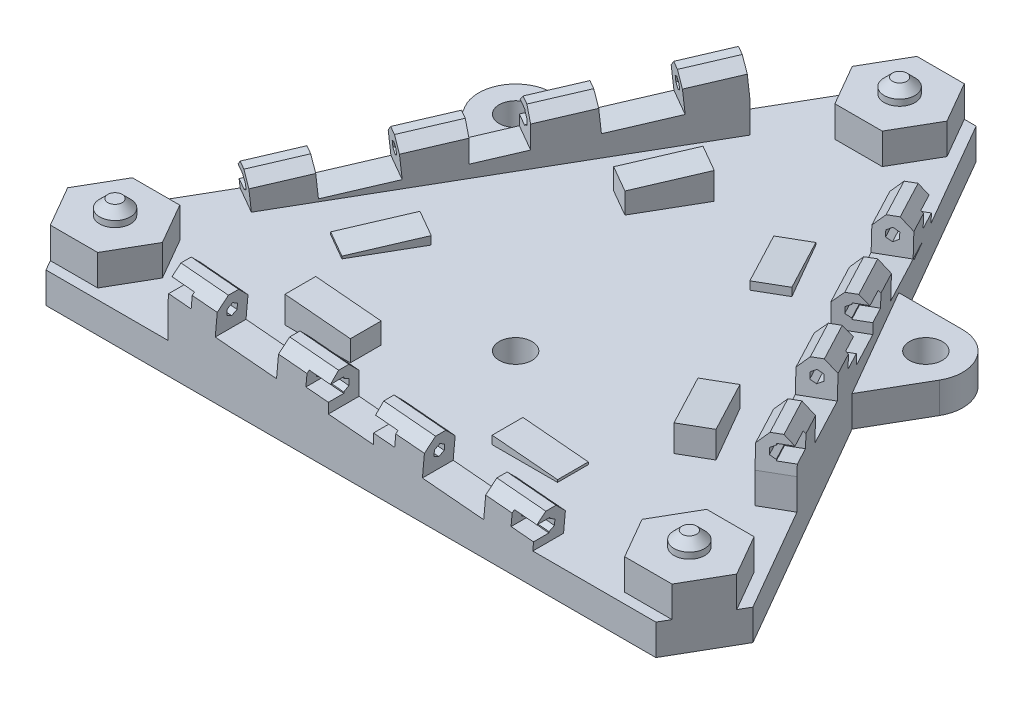
from build123d import *

# Parameters (mm, degrees)
BOSS_EXTRUDE1_DEPTH  = 3
SKETCH1_3_R          = 1.5
BOSS_EXTRUDE2_DEPTH  = 6
SKETCH1_4_R          = 1.5
BOSS_EXTRUDE3_DEPTH  = 7.4
BOSS_EXTRUDE7_DEPTH  = 10
CUT_EXTRUDE4_DEPTH   = 7
BOSS_EXTRUDE4_DEPTH  = 3
CUT_EXTRUDE1_REACH   = 65.43
SKETCH3_R            = 0.5
BOSS_EXTRUDE8_DEPTH  = 10
CUT_EXTRUDE5_DEPTH   = 7
BOSS_EXTRUDE5_DEPTH  = 3
CUT_EXTRUDE2_REACH   = 58.698
SKETCH7_R            = 0.5
BOSS_EXTRUDE9_DEPTH  = 10
CUT_EXTRUDE6_DEPTH   = 7
BOSS_EXTRUDE6_DEPTH  = 3
CUT_EXTRUDE3_REACH   = 69.71
SKETCH9_R            = 0.5
CHAMFER1_SIZE        = 1
SKETCH11_R           = 3.6
SKETCH11_R_2         = 1.6
BOSS_EXTRUDE10_DEPTH = 3
SKETCH11_3_R         = 1.6
CUT_EXTRUDE8_DEPTH   = 3
CUT_EXTRUDE9_DEPTH   = 1.5
CUT_EXTRUDE10_DEPTH  = 1.5
CUT_EXTRUDE11_DEPTH  = 1.5
CHAMFER2_SIZE        = 0.8


# Read off the part's stored shape, not the designer's step: Cut-Extrude4, Cut-Extrude5, Cut-Extrude6
with BuildPart() as part:
    # Sketch1 → Boss-Extrude1 (new body)
    with BuildSketch(Plane(origin=(0, 0, 0), x_dir=(1, 0, 0), z_dir=(0, 1, 0))):
        Polygon((-32.618802154, -16.165807537), (-33.196152423, -15.165807537), (-3.464101615, 36.331615075), (-2.309401077, 36.331615075), (-4.618802154, 32.331615075), (-2.309401077, 28.331615075), (2.309401077, 28.331615075), (4.618802154, 32.331615075), (2.309401077, 36.331615075), (3.464101615, 36.331615075), (33.196152423, -15.165807537), (32.618802154, -16.165807537), (30.309401077, -12.165807537), (25.690598923, -12.165807537), (23.381197846, -16.165807537), (25.690598923, -20.165807537), (30.309401077, -20.165807537), (29.732050808, -21.165807537), (-29.732050808, -21.165807537), (-30.309401077, -20.165807537), (-25.690598923, -20.165807537), (-23.381197846, -16.165807537), (-25.690598923, -12.165807537), (-30.309401077, -12.165807537), align=None)
    extrude(amount=BOSS_EXTRUDE1_DEPTH)

    # Sketch1<3> → Boss-Extrude2 (add)
    # profile 1 of 3: a face of its own
    with BuildSketch(Plane(origin=(0, 0, 0), x_dir=(1, 0, 0), z_dir=(0, 1, 0))):
        Polygon((-30.309401077, -12.165807537), (-32.618802154, -16.165807537), (-30.309401077, -20.165807537), (-25.690598923, -20.165807537), (-23.381197846, -16.165807537), (-25.690598923, -12.165807537), align=None)
        with Locations(Location((-28, -16.165807537, 0), (0, 0, 270))):
            Circle(SKETCH1_3_R, mode=Mode.SUBTRACT)
    # profile 2 of 3: a face of its own
    with BuildSketch(Plane(origin=(0, 0, 0), x_dir=(1, 0, 0), z_dir=(0, 1, 0))):
        Polygon((-2.309401077, 36.331615075), (-4.618802154, 32.331615075), (-2.309401077, 28.331615075), (2.309401077, 28.331615075), (4.618802154, 32.331615075), (2.309401077, 36.331615075), align=None)
        with Locations(Location((0, 32.331615075, 0), (0, 0, 270))):
            Circle(SKETCH1_3_R, mode=Mode.SUBTRACT)
    # profile 3 of 3: a face of its own
    with BuildSketch(Plane(origin=(0, 0, 0), x_dir=(1, 0, 0), z_dir=(0, 1, 0))):
        Polygon((23.381197846, -16.165807537), (25.690598923, -20.165807537), (30.309401077, -20.165807537), (32.618802154, -16.165807537), (30.309401077, -12.165807537), (25.690598923, -12.165807537), align=None)
        with Locations(Location((28, -16.165807537, 0), (0, 0, 270))):
            Circle(SKETCH1_3_R, mode=Mode.SUBTRACT)
    extrude(amount=BOSS_EXTRUDE2_DEPTH)

    # Sketch1<4> → Boss-Extrude3 (add)
    with BuildSketch(Plane(origin=(0, 0, 0), x_dir=(1, 0, 0), z_dir=(0, 1, 0))):
        with Locations(Location((-28, -16.165807537, 0), (0, 0, 270))):
            Circle(SKETCH1_4_R)
        with Locations(Location((28, -16.165807537, 0), (0, 0, 270))):
            Circle(SKETCH1_4_R)
        with Locations(Location((0, 32.331615075, 0), (0, 0, 270))):
            Circle(SKETCH1_4_R)
    extrude(amount=BOSS_EXTRUDE3_DEPTH)

    # Sketch2<3> → Boss-Extrude7 (add)
    with BuildSketch(Plane(origin=(0, 0, 21.165807537), x_dir=(-1, 0, 0), z_dir=(0, 0, -1))):
        Polygon((13.430346866, 3), (13.430346866, 5.604911719), (13.230346866, 5.587063289), (7.254097578, 5.053729955), (7.054097578, 5.035881525), (7.054097578, 3), align=None)
        Polygon((-13.145902422, 3), (-6.769653134, 3), (-6.769653134, 3.802220296), (-6.969653134, 3.784371866), (-12.945902422, 3.251038532), (-13.145902422, 3.233190102), align=None)
    extrude(amount=BOSS_EXTRUDE7_DEPTH)

    # Cut-Extrude4 outline → Cut-Extrude4 (cut)
    with BuildSketch(Plane(origin=(0, 0, 21.165807537), x_dir=(-1, 0, 0), z_dir=(0, 0, -1))):
        Polygon((-13.145902422, 3), (-6.769653134, 3), (-6.769653134, 3.802220296), (-13.145902422, 3.233190102), align=None)
        Polygon((7.054097578, 3), (13.430346866, 3), (13.430346866, 5.604911719), (7.054097578, 5.035881525), align=None)
    extrude(amount=CUT_EXTRUDE4_DEPTH, mode=Mode.SUBTRACT)

    # Sketch2 → Boss-Extrude4 (add)
    with BuildSketch(Plane(origin=(0, 0, 21.165807537), x_dir=(-1, 0, 0), z_dir=(0, 0, -1))):
        Polygon((17.85749573, 3), (17.85749573, 6), (17.574177245, 9.174716049), (12.947028382, 8.761779338), (13.230346866, 5.587063289), (7.254097578, 5.053729955), (6.970779093, 8.228446005), (2.2, 7.802691423), (2.2, 4.602691423), (-2.2, 4.210025964), (-2.2, 7.410025964), (-7.252971618, 6.959087915), (-6.969653134, 3.784371866), (-12.945902422, 3.251038532), (-13.229220907, 6.425754582), (-18, 6), (-17.732273551, 3), align=None)
    extrude(amount=BOSS_EXTRUDE4_DEPTH)

    # Cut-Extrude1: up to this face of the body (flat: up to its plane)
    cut_extrude1_end = Plane(part.part.faces().sort_by_distance((17.866136776, 4.5, 19.665807537))[0])
    # Sketch3 → Cut-Extrude1 (cut, up to the picked face)
    with BuildSketch(Plane(origin=(-18.247621626, 1.62845698, 0), x_dir=(0, 0, 1), z_dir=(-0.9960415480451098, 0.0888888888888896, 0)), mode=Mode.PRIVATE) as cut_extrude1_sk1:
        with Locations((19.665807537, 6.076249288)):
            Circle(SKETCH3_R)
    cut_extrude1_tool1 = split(extrude(cut_extrude1_sk1.sketch, amount=-CUT_EXTRUDE1_REACH, mode=Mode.PRIVATE), bisect_by=cut_extrude1_end, keep=Keep.BOTH, mode=Mode.PRIVATE)
    # Sketch3 → Cut-Extrude1 (cut, up to the picked face)
    with BuildSketch(Plane(origin=(-18.247621626, 1.62845698, 0), x_dir=(0, 0, 1), z_dir=(-0.9960415480451098, 0.0888888888888896, 0)), mode=Mode.PRIVATE) as cut_extrude1_sk2:
        Polygon((20.165807537, 5.787574154), (20.165807537, 6.364924423), (19.665807537, 6.653599557), (19.165807537, 6.364924423), (19.165807537, 5.787574154), (19.665807537, 5.498899019), align=None)
    cut_extrude1_tool2 = split(extrude(cut_extrude1_sk2.sketch, amount=-CUT_EXTRUDE1_REACH, mode=Mode.PRIVATE), bisect_by=cut_extrude1_end, keep=Keep.BOTH, mode=Mode.PRIVATE)
    add(cut_extrude1_tool1.solids().sort_by(Axis((-17.707511, 7.680654, 19.665808), (0.9960415480451098, -0.0888888888888896, 0)))[0], mode=Mode.SUBTRACT)
    add(cut_extrude1_tool2.solids().sort_by(Axis((-17.707511, 7.680654, 19.665808), (0.9960415480451098, -0.0888888888888896, 0)))[0], mode=Mode.SUBTRACT)

    # Sketch4<3> → Boss-Extrude8 (add)
    with BuildSketch(Plane(origin=(-18.330127019, 0, -10.582903769), x_dir=(0.4999999999999999, 0, -0.8660254037844387), z_dir=(0.8660254037844388, 0, 0.49999999999999994))):
        Polygon((-13.145902422, 3), (-6.769653134, 3), (-6.769653134, 3.802220296), (-6.969653134, 3.784371866), (-12.945902422, 3.251038532), (-13.145902422, 3.233190102), align=None)
        Polygon((13.430346866, 3), (13.430346866, 5.604911719), (13.230346866, 5.587063289), (7.254097578, 5.053729955), (7.054097578, 5.035881525), (7.054097578, 3), align=None)
    extrude(amount=BOSS_EXTRUDE8_DEPTH)

    # Cut-Extrude5 outline → Cut-Extrude5 (cut)
    with BuildSketch(Plane(origin=(-18.330127019, 0, -10.582903769), x_dir=(0.4999999999999999, 0, -0.8660254037844387), z_dir=(0.8660254037844388, 0, 0.49999999999999994))):
        Polygon((7.054097578, 5.035881525), (7.054097578, 3), (13.430346866, 3), (13.430346866, 5.604911719), align=None)
        Polygon((-13.145902422, 3.233190102), (-13.145902422, 3), (-6.769653134, 3), (-6.769653134, 3.802220296), align=None)
    extrude(amount=CUT_EXTRUDE5_DEPTH, mode=Mode.SUBTRACT)

    # Sketch4 → Boss-Extrude5 (add)
    with BuildSketch(Plane(origin=(-18.330127019, 0, -10.582903769), x_dir=(0.4999999999999999, 0, -0.8660254037844387), z_dir=(0.8660254037844388, 0, 0.49999999999999994))):
        Polygon((17.85749573, 3), (17.85749573, 6), (17.574177245, 9.174716049), (12.947028382, 8.761779338), (13.230346866, 5.587063289), (7.254097578, 5.053729955), (6.970779093, 8.228446005), (2.2, 7.802691423), (2.2, 4.602691423), (-2.2, 4.210025964), (-2.2, 7.410025964), (-7.252971618, 6.959087915), (-6.969653134, 3.784371866), (-12.945902422, 3.251038532), (-13.229220907, 6.425754582), (-18, 6), (-17.732273551, 3), align=None)
    extrude(amount=BOSS_EXTRUDE5_DEPTH)

    # Cut-Extrude2: up to this face of the body (flat: up to its plane)
    cut_extrude2_end = Plane(part.part.faces().sort_by_distance((-25.964157301, 4.5, 5.639624546))[0])
    # Sketch7 → Cut-Extrude2 (cut, up to the picked face)
    with BuildSketch(Plane(origin=(9.123810813, 1.62845698, -15.802903887), x_dir=(-0.8671650988375716, 0.05104969434977375, -0.49539743647380663), z_dir=(0.49802077402255485, 0.08888888888888896, -0.8625972838318436)), mode=Mode.PRIVATE) as cut_extrude2_sk1:
        with Locations((19.951384644, 5.060340134)):
            Circle(SKETCH7_R)
    cut_extrude2_tool1 = split(extrude(cut_extrude2_sk1.sketch, amount=-CUT_EXTRUDE2_REACH, mode=Mode.PRIVATE), bisect_by=cut_extrude2_end, keep=Keep.BOTH, mode=Mode.PRIVATE)
    # Sketch7 → Cut-Extrude2 (cut, up to the picked face)
    with BuildSketch(Plane(origin=(9.123810813, 1.62845698, -15.802903887), x_dir=(-0.8671650988375716, 0.05104969434977375, -0.49539743647380663), z_dir=(0.49802077402255485, 0.08888888888888896, -0.8625972838318436)), mode=Mode.PRIVATE) as cut_extrude2_sk2:
        Polygon((20.435932162, 4.746418111), (20.46552285, 5.323009582), (19.980975333, 5.636931605), (19.466837127, 5.374262158), (19.437246439, 4.797670686), (19.921793956, 4.483748663), align=None)
    cut_extrude2_tool2 = split(extrude(cut_extrude2_sk2.sketch, amount=-CUT_EXTRUDE2_REACH, mode=Mode.PRIVATE), bisect_by=cut_extrude2_end, keep=Keep.BOTH, mode=Mode.PRIVATE)
    add(cut_extrude2_tool1.solids().sort_by(Axis((-8.177334, 7.680654, -25.168058), (-0.49802077402255485, -0.08888888888888896, 0.8625972838318436)))[0], mode=Mode.SUBTRACT)
    add(cut_extrude2_tool2.solids().sort_by(Axis((-8.177334, 7.680654, -25.168058), (-0.49802077402255485, -0.08888888888888896, 0.8625972838318436)))[0], mode=Mode.SUBTRACT)

    # Sketch8<3> → Boss-Extrude9 (add)
    with BuildSketch(Plane(origin=(18.330127019, 6, -10.582903769), x_dir=(-0.5000000000000006, 0, -0.8660254037844384), z_dir=(-0.8660254037844385, 0, 0.5000000000000006))):
        Polygon((13.145902422, 2.779527285), (13.145902422, 3), (6.769653134, 3), (6.769653134, 2.210497092), (6.969653134, 2.228345522), (12.945902422, 2.761678855), align=None)
        Polygon((-7.054097578, 0.976835862), (-7.054097578, 3), (-13.430346866, 3), (-13.430346866, 0.407805669), (-13.230346866, 0.425654099), (-7.254097578, 0.958987432), align=None)
    extrude(amount=BOSS_EXTRUDE9_DEPTH)

    # Cut-Extrude6 outline → Cut-Extrude6 (cut)
    with BuildSketch(Plane(origin=(18.330127019, 6, -10.582903769), x_dir=(-0.5000000000000006, 0, -0.8660254037844384), z_dir=(-0.8660254037844385, 0, 0.5000000000000006))):
        Polygon((13.145902422, 3), (6.769653134, 3), (6.769653134, 2.210497092), (13.145902422, 2.779527285), align=None)
        Polygon((-7.054097578, 3), (-13.430346866, 3), (-13.430346866, 0.407805669), (-7.054097578, 0.976835862), align=None)
    extrude(amount=CUT_EXTRUDE6_DEPTH, mode=Mode.SUBTRACT)

    # Sketch8 → Boss-Extrude6 (add)
    with BuildSketch(Plane(origin=(18.330127019, 6, -10.582903769), x_dir=(-0.5000000000000006, 0, -0.8660254037844384), z_dir=(-0.8660254037844385, 0, 0.5000000000000006))):
        Polygon((17.732273551, 3), (15.616402247, 3), (13.145902422, 2.779527285), (13.145902422, 3), (-18, 3), (-18, 0), (-17.715555556, -3.187332954), (-12.945902422, -2.761678855), (-13.230346866, 0.425654099), (-7.254097578, 0.958987432), (-6.969653134, -2.228345522), (-2.2, -1.802691423), (-2.2, 1.410025964), (2.2, 1.802691423), (2.2, -1.410025964), (7.254097578, -0.958987432), (6.969653134, 2.228345522), (12.945902422, 2.761678855), (13.230346866, -0.425654099), (18, 0), align=None)
    extrude(amount=BOSS_EXTRUDE6_DEPTH)

    # Cut-Extrude3: up to this face of the body (flat: up to its plane)
    cut_extrude3_end = Plane(part.part.faces().sort_by_distance((8.098020525, 4.5, -25.305432084))[0])
    # Sketch9 → Cut-Extrude3 (cut, up to the picked face)
    with BuildSketch(Plane(origin=(9.194499968, 1.641073884, 15.925341095), x_dir=(0.8671650988375714, -0.05104969434977381, -0.49539743647380724), z_dir=(0.4980207740225554, 0.08888888888888895, 0.8625972838318433)), mode=Mode.PRIVATE) as cut_extrude3_sk1:
        with Locations((19.328537797, 7.076186694)):
            Circle(SKETCH9_R)
    cut_extrude3_tool1 = split(extrude(cut_extrude3_sk1.sketch, amount=-CUT_EXTRUDE3_REACH, mode=Mode.PRIVATE), bisect_by=cut_extrude3_end, keep=Keep.BOTH, mode=Mode.PRIVATE)
    # Sketch9 → Cut-Extrude3 (cut, up to the picked face)
    with BuildSketch(Plane(origin=(9.194499968, 1.641073884, 15.925341095), x_dir=(0.8671650988375714, -0.05104969434977381, -0.49539743647380724), z_dir=(0.4980207740225554, 0.08888888888888895, 0.8625972838318433)), mode=Mode.PRIVATE) as cut_extrude3_sk2:
        Polygon((19.842676003, 6.813517246), (19.813085315, 7.390108717), (19.298947109, 7.652778165), (18.814399592, 7.338856142), (18.84399028, 6.762264671), (19.358128485, 6.499595223), align=None)
    cut_extrude3_tool2 = split(extrude(cut_extrude3_sk2.sketch, amount=-CUT_EXTRUDE3_REACH, mode=Mode.PRIVATE), bisect_by=cut_extrude3_end, keep=Keep.BOTH, mode=Mode.PRIVATE)
    add(cut_extrude3_tool1.solids().sort_by(Axis((25.955533, 7.693271, 5.624687), (-0.4980207740225554, -0.08888888888888895, -0.8625972838318433)))[0], mode=Mode.SUBTRACT)
    add(cut_extrude3_tool2.solids().sort_by(Axis((25.955533, 7.693271, 5.624687), (-0.4980207740225554, -0.08888888888888895, -0.8625972838318433)))[0], mode=Mode.SUBTRACT)

    # Chamfer1
    chamfer1_edges = [part.edges().sort_by_distance(p)[0] for p in [
        (-15.260602813, 8.968247694, 18.165807537),
        (-4.585389547, 8.015568714, 18.165807537),
        (4.726485809, 7.18455694, 18.165807537),
        (15.614610453, 6.212877291, 18.165807537),
        (15.614610453, 6.212877291, 21.165807537),
        (4.726485809, 7.18455694, 21.165807537),
        (-4.585389547, 8.015568714, 21.165807537),
        (-15.260602813, 8.968247694, 21.165807537),
        (-8.101749401, 8.968247694, -22.298973482),
        (-13.439356034, 8.015568714, -13.053967602),
        (-18.095293712, 7.18455694, -4.989646987),
        (-23.539356034, 6.212877291, 4.439745554),
        (-26.137432246, 6.212877291, 2.939745554),
        (-20.693369924, 7.18455694, -6.489646987),
        (-16.037432246, 8.015568714, -14.553967602),
        (-10.699825612, 8.968247694, -23.798973482),
        (25.995491513, 8.974505904, 2.693896994),
        (20.622540302, 8.015518472, -6.61232749),
        (15.966602624, 7.184506698, -14.676648105),
        (10.522540302, 6.212827049, -24.106040646),
        (23.397415302, 8.974505904, 4.193896994),
        (18.024464091, 8.015518472, -5.11232749),
        (13.368526413, 7.184506698, -13.176648105),
        (7.924464091, 6.212827049, -22.606040646),
    ]]
    chamfer(chamfer1_edges, length=CHAMFER1_SIZE)

    # Sketch11 → Boss-Extrude10 (add)
    # profile 1 of 6: a face of its own
    with BuildSketch(Plane.XZ):
        with Locations((20, -14.890598923)):
            Circle(SKETCH11_R)
        with Locations(Location((20, -14.890598923, 0), (0, 0, 270))):
            Circle(SKETCH11_R_2, mode=Mode.SUBTRACT)
    # profile 2 of 6: a face of its own
    with BuildSketch(Plane.XZ):
        with BuildLine():
            ThreePointArc((20, -18.490598923), (16.882308534, -16.690598902), (16.882308571, -13.090598881))
            Line((16.882308571, -13.090598881), (13.764617093, -18.490598923))
            Line((13.764617093, -18.490598923), (20, -18.490598923))
        make_face()
    # profile 3 of 6: a face of its own
    with BuildSketch(Plane.XZ):
        with BuildLine():
            ThreePointArc((16.882308571, -13.090598881), (20.000000024, -11.290598923), (23.117691454, -13.090598923))
            Line((23.117691454, -13.090598923), (20, -7.690598923))
            Line((20, -7.690598923), (16.882308571, -13.090598881))
        make_face()
    # profile 4 of 6: a face of its own
    with BuildSketch(Plane.XZ):
        with BuildLine():
            Line((-20, -7.690598923), (-23.117691454, -13.090598923))
            ThreePointArc((-23.117691454, -13.090598923), (-19.999999974, -11.290598923), (-16.88230852, -13.090598968))
            Line((-16.88230852, -13.090598968), (-20, -7.690598923))
        make_face()
    # profile 5 of 6: a face of its own
    with BuildSketch(Plane.XZ):
        with BuildLine():
            ThreePointArc((-16.4, -14.890598923), (-17.454415588, -17.436183336), (-20, -18.490598923))
            Line((-20, -18.490598923), (-13.764617093, -18.490598923))
            Line((-13.764617093, -18.490598923), (-16.88230852, -13.090598968))
            ThreePointArc((-16.88230852, -13.090598968), (-16.522667019, -13.958850386), (-16.4, -14.890598923))
        make_face()
    # profile 6 of 6: a face of its own
    with BuildSketch(Plane.XZ):
        with Locations((-20, -14.890598923)):
            Circle(SKETCH11_R)
        with Locations(Location((-20, -14.890598923, 0), (0, 0, 270))):
            Circle(SKETCH11_R_2, mode=Mode.SUBTRACT)
    extrude(amount=-BOSS_EXTRUDE10_DEPTH)

    # Sketch11<3> → Cut-Extrude8 (cut)
    with BuildSketch(Plane.XZ):
        with Locations(Location((0, 5.109401077, 0), (0, 0, 270))):
            Circle(SKETCH11_3_R)
    extrude(amount=-CUT_EXTRUDE8_DEPTH, mode=Mode.SUBTRACT)

    # Sketch12 → Cut-Extrude9 (cut)
    with BuildSketch(Plane(origin=(-18.330127019, 0, -10.582903769), x_dir=(-0.4999999999999999, 0, 0.8660254037844387), z_dir=(-0.8660254037844388, 0, -0.49999999999999994))):
        Polygon((-17.7697328, 6.983424644), (-15.578441395, 6.787869088), (-15.45399695, 8.182327255), (-17.645288356, 8.377882811), align=None)
        Polygon((-4.266846961, 7.183961942), (-4.391291406, 5.789503775), (-2.2, 5.593948219), (-2.075555556, 6.988406386), align=None)
        Polygon((17.928888889, 5.203166762), (15.737597483, 5.398722317), (15.613153039, 4.00426415), (17.804444444, 3.808708594), align=None)
        Polygon((2.2, 6.606846618), (4.391291406, 6.411291062), (4.266846961, 5.016832895), (2.075555556, 5.21238845), align=None)
    extrude(amount=-CUT_EXTRUDE9_DEPTH, mode=Mode.SUBTRACT)

    # Sketch13 → Cut-Extrude10 (cut)
    with BuildSketch(Plane(origin=(18.330127019, 0, -10.582903769), x_dir=(-0.5000000000000006, 0, -0.8660254037844384), z_dir=(0.8660254037844385, 0, -0.5000000000000006))):
        Polygon((-17.911111111, 6.996041548), (-15.719819705, 6.800485992), (-15.595375261, 8.19494416), (-17.786666667, 8.390499715), align=None)
        Polygon((-4.266846961, 7.183961942), (-4.391291406, 5.789503775), (-2.2, 5.593948219), (-2.075555556, 6.988406386), align=None)
        Polygon((17.928888889, 5.203166762), (15.737597483, 5.398722317), (15.613153039, 4.00426415), (17.804444444, 3.808708594), align=None)
        Polygon((2.2, 6.606846618), (4.391291406, 6.411291062), (4.266846961, 5.016832895), (2.075555556, 5.21238845), align=None)
    extrude(amount=-CUT_EXTRUDE10_DEPTH, mode=Mode.SUBTRACT)

    # Sketch14 → Cut-Extrude11 (cut)
    with BuildSketch(Plane.XY.offset(21.165807537)):
        Polygon((-17.7697328, 6.983424644), (-15.578441395, 6.787869088), (-15.45399695, 8.182327255), (-17.645288356, 8.377882811), align=None)
        Polygon((-4.266846961, 7.183961942), (-4.391291406, 5.789503775), (-2.2, 5.593948219), (-2.075555556, 6.988406386), align=None)
        Polygon((17.929173981, 5.206361354), (15.737882576, 5.40191691), (15.613438131, 4.007458743), (17.804729537, 3.811903187), align=None)
        Polygon((2.2, 6.606846618), (4.391291406, 6.411291062), (4.266846961, 5.016832895), (2.075555556, 5.21238845), align=None)
    extrude(amount=-CUT_EXTRUDE11_DEPTH, mode=Mode.SUBTRACT)

    # Chamfer2
    chamfer2_edges = [part.edges().sort_by_distance(p)[0] for p in [
        (-28, 7.4, 14.665807537),
        (28, 7.4, 14.665807537),
        (0, 7.4, -33.831615075),
    ]]
    chamfer(chamfer2_edges, length=CHAMFER2_SIZE)


solid = part.part
